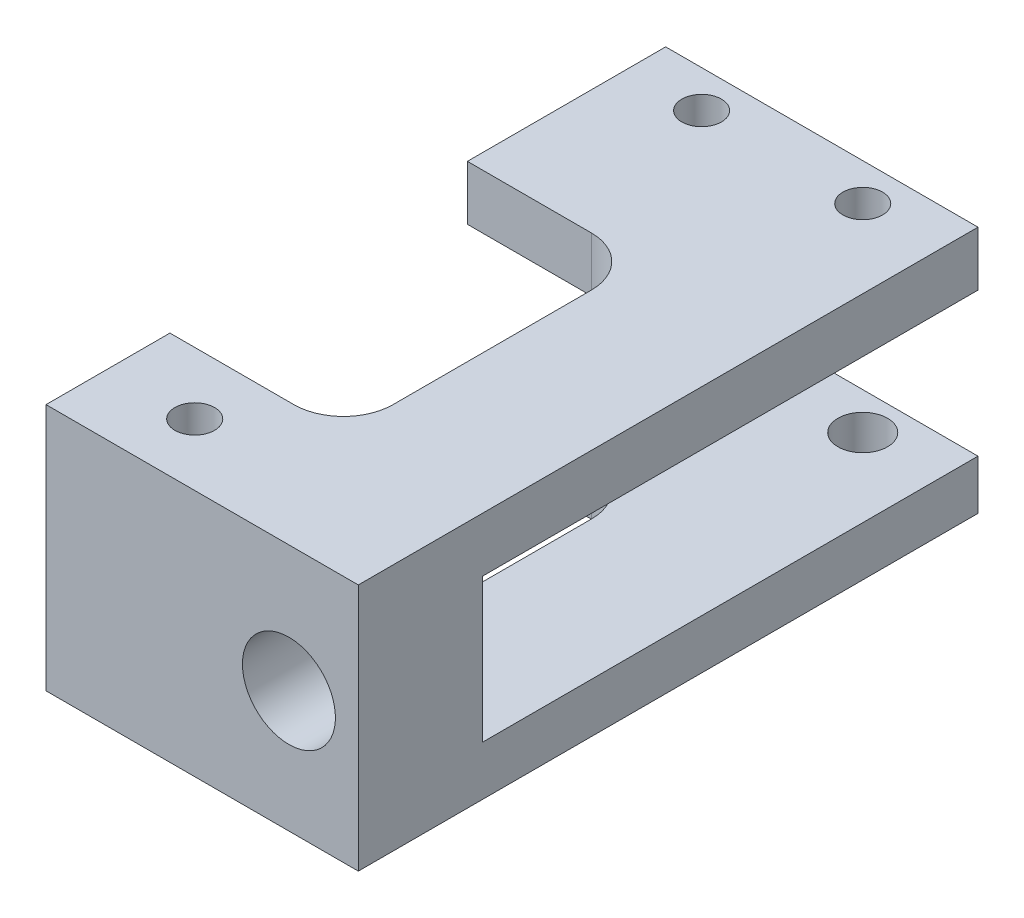
from build123d import *

# Parameters (mm, degrees)
SKETCH1_W                   = 12.6
SKETCH1_H                   = 25
BOSS_EXTRUDE1_DEPTH         = 10
CUT_EXTRUDE1_START          = -5
SKETCH2_W                   = 7
SKETCH2_H                   = 5.8
CUT_EXTRUDE1_DEPTH          = 23.653028767
SKETCH3_W                   = 20
SKETCH3_H                   = 5.8
CUT_EXTRUDE2_DEPTH          = 18.47140521
SKETCH6_R                   = 1
CUT_EXTRUDE5_DEPTH          = 17.122654868
TAP_DRILL_FOR_M2X0_4_TAP1_D = 1.6
CUT_EXTRUDE6_DEPTH          = 17.122654868
CUT_EXTRUDE6_DEPTH_BACK     = 17.122654868
SKETCH9_W                   = 7
SKETCH9_H                   = 12
FILLET1_R                   = 2
SKETCH4_R                   = 1.875
CUT_EXTRUDE7_DEPTH          = 24.231228982
TAP_DRILL_FOR_M2X0_4_TAP4_D = 1.6


with BuildPart() as part:
    # Sketch1 → Boss-Extrude1 (new body)
    with BuildSketch(Plane(origin=(0, 0, 0), x_dir=(1, 0, 0), z_dir=(0, 1, 0))):
        Rectangle(SKETCH1_W, SKETCH1_H)
    extrude(amount=BOSS_EXTRUDE1_DEPTH)

    # Sketch2 → Cut-Extrude1 (cut, through all)
    with BuildSketch(Plane.XY.offset(12.5).offset(CUT_EXTRUDE1_START)):
        with Locations((-2.8, 4.9)):
            Rectangle(SKETCH2_W, SKETCH2_H)
    extrude(amount=-CUT_EXTRUDE1_DEPTH, mode=Mode.SUBTRACT)

    # Sketch3 → Cut-Extrude2 (cut, through all)
    with BuildSketch(Plane.ZY.offset(-0.7)):
        with Locations((-2.5, 4.9)):
            Rectangle(SKETCH3_W, SKETCH3_H)
    extrude(amount=-CUT_EXTRUDE2_DEPTH, mode=Mode.SUBTRACT)

    # Sketch6 → Cut-Extrude5 (cut, through all)
    with BuildSketch(Plane(origin=(0, 2, 0), x_dir=(1, 0, 0), z_dir=(0, 1, 0))):
        with Locations((3.15, 11)):
            Circle(SKETCH6_R)
        with Locations((-3.35, 11)):
            Circle(SKETCH6_R)
    extrude(amount=-CUT_EXTRUDE5_DEPTH, mode=Mode.SUBTRACT)

    # Tap Drill for M2x0.4 Tap1 (through all)
    with Locations(Plane(origin=(3.15, 10, -11), x_dir=(0, 0, 1), z_dir=(0, 1, 0))):
        with Locations((0, 0), (0, -6.5)):
            Hole(TAP_DRILL_FOR_M2X0_4_TAP1_D / 2)

    # Sketch9 → Cut-Extrude6 (cut, two sides: drawn at the far end of the back side and taken through both)
    with BuildSketch(Plane(origin=(0, 2, 0), x_dir=(1, 0, 0), z_dir=(0, 1, 0)).offset(-CUT_EXTRUDE6_DEPTH_BACK)):
        with Locations((-2.8, -1.5)):
            Rectangle(SKETCH9_W, SKETCH9_H)
    extrude(amount=CUT_EXTRUDE6_DEPTH + CUT_EXTRUDE6_DEPTH_BACK, mode=Mode.SUBTRACT)

    # Fillet1
    fillet1_edges = [part.edges().sort_by_distance(p)[0] for p in [
        (0.7, 1, -4.5),
        (0.7, 1, 7.5),
        (0.7, 8.9, -4.5),
        (0.7, 8.9, 7.5),
    ]]
    fillet(fillet1_edges, radius=FILLET1_R)

    # Sketch4 → Cut-Extrude7 (cut, through all)
    with BuildSketch(Plane(origin=(0, 0, 7.5), x_dir=(-1, 0, 0), z_dir=(0, 0, -1))):
        with Locations((-3.5, 4.9)):
            Circle(SKETCH4_R)
    extrude(amount=-CUT_EXTRUDE7_DEPTH, mode=Mode.SUBTRACT)

    # Tap Drill for M2x0.4 Tap4 (through all)
    with Locations(Plane(origin=(-2.8, 10, 10), x_dir=(0, 0, 1), z_dir=(0, 1, 0))):
        with Locations((0, 0)):
            Hole(TAP_DRILL_FOR_M2X0_4_TAP4_D / 2)


solid = part.part
